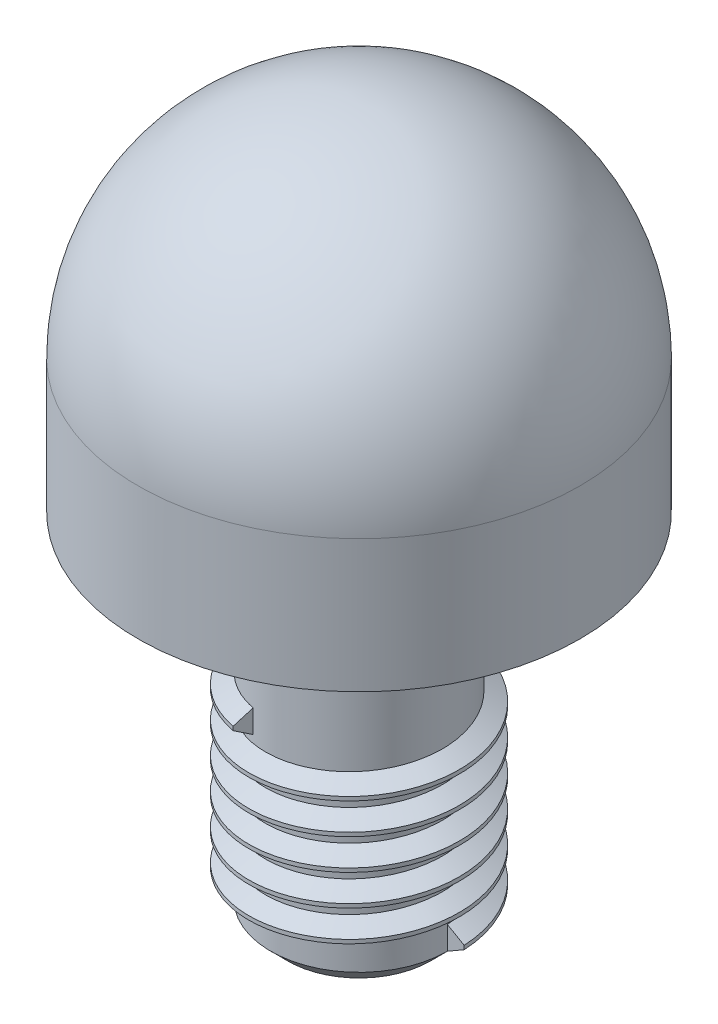
from build123d import *

# Parameters (mm, degrees)
SCHIZZO1_W                   = 5
SCHIZZO1_H                   = 8
SCHIZZO2_R                   = 2
ESTRUSIONE_ESTRUSIONE1_DEPTH = 8
SMUSSO2_SIZE                 = 0.38
FILETTATURA1_PITCH           = 0.7
RACCORDO1_R                  = 5


with BuildPart() as part:
    # Schizzo1 → Rivoluzione1 (revolve)
    with BuildSketch(Plane.XY):
        with Locations((2.5, 4)):
            Rectangle(SCHIZZO1_W, SCHIZZO1_H)
    revolve(axis=Axis((0, 0, 0), (0, 1, 0)))

    # Schizzo2 → Estrusione-Estrusione1 (add)
    with BuildSketch(Plane.XZ):
        Circle(SCHIZZO2_R)
    extrude(amount=ESTRUSIONE_ESTRUSIONE1_DEPTH)

    # Smusso2
    smusso2_edges = [part.edges().sort_by_distance(p)[0] for p in [
        (-2, -8, 0),
    ]]
    chamfer(smusso2_edges, length=SMUSSO2_SIZE)

    # Filettatura1: the profile of Profilo filettatura2 profile screwed along a right-hand helix of 5.714286 turns, 6 arcs to a turn; built about Z, then put on its axis
    filettatura1_z = Axis((0, 0, 0), (0, 0, 1))
    filettatura1_corners = [(1.9997, 0, -0.000173205), (2.378886113, 0, 0.218749999), (2.378886113, 0, 0.306249999), (1.9997, 0, 0.525173203)]
    with BuildLine(mode=Mode.PRIVATE) as filettatura1_profile:
        Line(filettatura1_corners[0], filettatura1_corners[1])
        Line(filettatura1_corners[1], filettatura1_corners[2])
        Line(filettatura1_corners[2], filettatura1_corners[3])
        Line(filettatura1_corners[3], filettatura1_corners[0])
    filettatura1_cap = Face(filettatura1_profile.wire())
    filettatura1_turn_angles = [0, 30, 60, 90, 120, 150, 180, 210, 240, 270, 300, 330, 360]
    filettatura1_turn_weights = [1, 0.8660254037844387, 1, 0.8660254037844387, 1, 0.8660254037844387, 1, 0.8660254037844387, 1, 0.8660254037844387, 1, 0.8660254037844387, 1]
    filettatura1_turn_rails = [Edge.make_bspline([Vector(p[0], p[1], 0).rotate(filettatura1_z, filettatura1_turn_angles[k]) / filettatura1_turn_weights[k] + Vector(0, 0, p[2] + FILETTATURA1_PITCH * filettatura1_turn_angles[k] / 360) for k in range(13)], [0, 0, 0, 1, 1, 2, 2, 3, 3, 4, 4, 5, 5, 6, 6, 6], 2, filettatura1_turn_weights) for p in filettatura1_corners]
    filettatura1_turn_sides = [Face.make_surface_from_curves(filettatura1_turn_rails[p[0]], filettatura1_turn_rails[p[1]]) for p in [(0, 1), (1, 2), (2, 3), (3, 0)]]
    filettatura1_last_angles = [1800, 1830, 1860, 1890, 1920, 1950, 1980, 2010, 2040, 2048.571428571, 2057.142857143]
    filettatura1_last_weights = [1, 0.8660254037844387, 1, 0.8660254037844387, 1, 0.8660254037844387, 1, 0.8660254037844387, 1, 0.9888308262251283, 1]
    filettatura1_last_rails = [Edge.make_bspline([Vector(p[0], p[1], 0).rotate(filettatura1_z, filettatura1_last_angles[k]) / filettatura1_last_weights[k] + Vector(0, 0, p[2] + FILETTATURA1_PITCH * filettatura1_last_angles[k] / 360) for k in range(11)], [0, 0, 0, 1, 1, 2, 2, 3, 3, 4, 4, 5, 5, 5], 2, filettatura1_last_weights) for p in filettatura1_corners]
    filettatura1_last_sides = [Face.make_surface_from_curves(filettatura1_last_rails[p[0]], filettatura1_last_rails[p[1]]) for p in [(0, 1), (1, 2), (2, 3), (3, 0)]]
    filettatura1 = Plane(origin=(0, -7.62, 0), x_dir=(1, 0, 0), z_dir=(0, 1, 0)) * Solid(Shell([*[p.moved(Location((0, 0, FILETTATURA1_PITCH * i))) for i in range(5) for p in filettatura1_turn_sides], *filettatura1_last_sides, filettatura1_cap, filettatura1_cap.rotate(filettatura1_z, 2057.142857143).moved(Location((0, 0, FILETTATURA1_PITCH * 2057.142857143 / 360)))]))
    add(filettatura1)

    # Raccordo1
    raccordo1_edges = [part.edges().sort_by_distance(p)[0] for p in [
        (-5, 8, 0),
    ]]
    fillet(raccordo1_edges, radius=RACCORDO1_R)


solid = part.part
